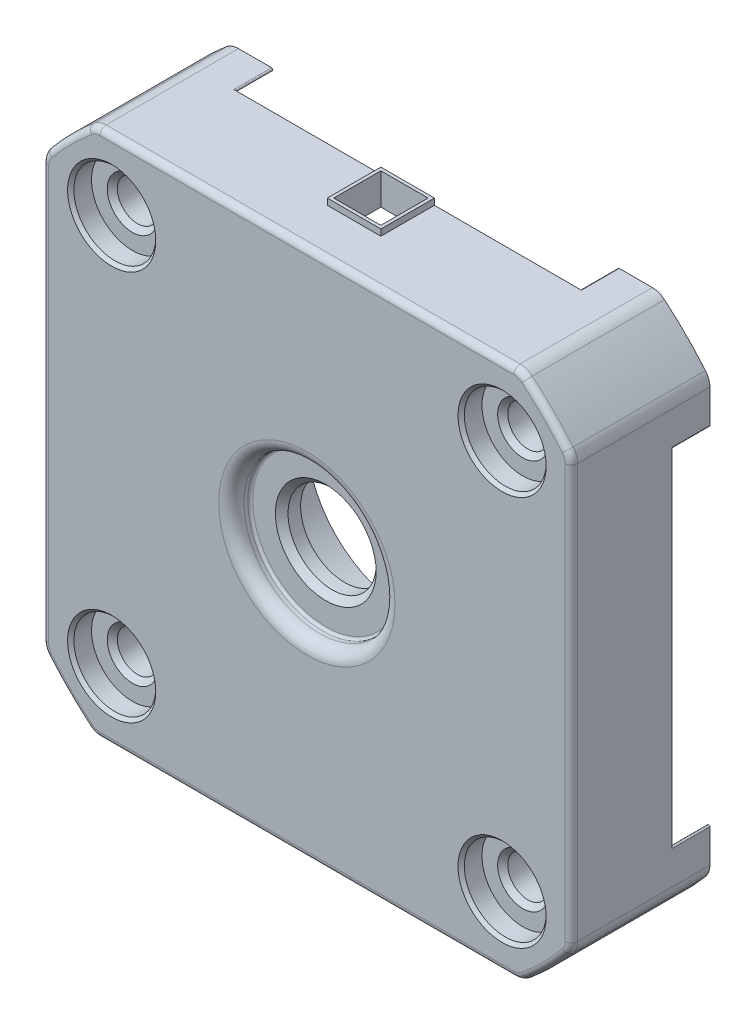
from build123d import *

# Parameters (mm, degrees)
SKETCH1_W                               = 42
SKETCH1_H                               = 42
BOSS_EXTRUDE1_DEPTH                     = 8
BOSS_EXTRUDE2_DEPTH                     = 3
SKETCH3_R                               = 29.69848481
SKETCH3_R_2                             = 27
CUT_EXTRUDE1_DEPTH                      = 11
SKETCH4_R                               = 10
SKETCH4_R_2                             = 8
CUT_EXTRUDE2_DEPTH                      = 5
FILLET3_R                               = 5
FILLET4_R                               = 1.5
FILLET5_START                           = -4
FILLET5_DEPTH                           = 4
FILLET6_R                               = 0.5
FILLET7_R                               = 0.5
CBORE_FOR_M3_PAN_HEAD_SCREW2_AT_2_COUNT = 2
CBORE_FOR_M3_PAN_HEAD_SCREW2_AT_2_PITCH = 43.840620434
CBORE_FOR_M3_PAN_HEAD_SCREW2_AT_3_COUNT = 2
CBORE_FOR_M3_PAN_HEAD_SCREW2_AT_3_PITCH = 31
CBORE_FOR_M3_PAN_HEAD_SCREW2_AT_4_COUNT = 2
CBORE_FOR_M3_PAN_HEAD_SCREW2_AT_4_PITCH = 31
FILLET8_R                               = 1
SKETCH8_W                               = 4.25
SKETCH8_H                               = 4.25
CUT_EXTRUDE3_DEPTH                      = 2
SKETCH9_W                               = 4.25
SKETCH9_H                               = 4.25
SKETCH9_W_2                             = 3.75
SKETCH9_H_2                             = 3.75
BOSS_EXTRUDE3_DEPTH                     = 2.5


with BuildPart() as part:
    # Sketch1 → Boss-Extrude1 (new body)
    with BuildSketch(Plane.XY):
        Rectangle(SKETCH1_W, SKETCH1_H)
    extrude(amount=BOSS_EXTRUDE1_DEPTH)

    # Sketch2 → Boss-Extrude2 (add)
    with BuildSketch(Plane(origin=(0, 0, 0), x_dir=(-1, 0, 0), z_dir=(0, 0, -1))):
        with BuildLine():
            Line((-21, 12.806248475), (-21, 21))
            Line((-21, 21), (-12.806248475, 21))
            ThreePointArc((-12.806248475, 21), (-13.551604467, 20.886303511), (-14.229164972, 20.555555556))
            ThreePointArc((-14.229164972, 20.555555556), (-17.67766953, 17.67766953), (-20.555555556, 14.229164972))
            ThreePointArc((-20.555555556, 14.229164972), (-20.886303511, 13.551604467), (-21, 12.806248475))
        make_face()
        with BuildLine():
            Line((-21, -12.806248475), (-21, -21))
            Line((-21, -21), (-12.806248475, -21))
            ThreePointArc((-12.806248475, -21), (-13.551604467, -20.886303511), (-14.229164972, -20.555555556))
            ThreePointArc((-14.229164972, -20.555555556), (-17.67766953, -17.67766953), (-20.555555556, -14.229164972))
            ThreePointArc((-20.555555556, -14.229164972), (-20.886303511, -13.551604467), (-21, -12.806248475))
        make_face()
        with BuildLine():
            Line((21, 21), (12.806248475, 21))
            ThreePointArc((12.806248475, 21), (13.551604467, 20.886303511), (14.229164972, 20.555555556))
            ThreePointArc((14.229164972, 20.555555556), (17.67766953, 17.67766953), (20.555555556, 14.229164972))
            ThreePointArc((20.555555556, 14.229164972), (20.886303511, 13.551604467), (21, 12.806248475))
            Line((21, 12.806248475), (21, 21))
        make_face()
        with BuildLine():
            Line((21, -12.806248475), (21, -21))
            Line((21, -21), (12.806248475, -21))
            ThreePointArc((12.806248475, -21), (13.551604467, -20.886303511), (14.229164972, -20.555555556))
            ThreePointArc((14.229164972, -20.555555556), (17.67766953, -17.67766953), (20.555555556, -14.229164972))
            ThreePointArc((20.555555556, -14.229164972), (20.886303511, -13.551604467), (21, -12.806248475))
        make_face()
    extrude(amount=BOSS_EXTRUDE2_DEPTH)

    # Sketch3 → Cut-Extrude1 (cut)
    with BuildSketch(Plane(origin=(0, 0, -3), x_dir=(-1, 0, 0), z_dir=(0, 0, -1))):
        Circle(SKETCH3_R)
        Circle(SKETCH3_R_2, mode=Mode.SUBTRACT)
    extrude(amount=-CUT_EXTRUDE1_DEPTH, mode=Mode.SUBTRACT)

    # Sketch4 → Cut-Extrude2 (cut)
    # profile 1 of 2: a face of its own
    with BuildSketch(Plane(origin=(0, 0, 0), x_dir=(-1, 0, 0), z_dir=(0, 0, -1))):
        Polygon((7.870057685, -19), (19, -7.870057685), (19, 7.870057685), (7.870057685, 19), (-7.870057685, 19), (-19, 7.870057685), (-19, -7.870057685), (-7.870057685, -19), align=None)
        Circle(SKETCH4_R, mode=Mode.SUBTRACT)
    # profile 2 of 2: a face of its own
    with BuildSketch(Plane(origin=(0, 0, 0), x_dir=(-1, 0, 0), z_dir=(0, 0, -1))):
        Circle(SKETCH4_R_2)
    extrude(amount=-CUT_EXTRUDE2_DEPTH, mode=Mode.SUBTRACT)

    # Fillet3
    fillet3_edges = [part.edges().sort_by_distance(p)[0] for p in [
        (-19, -7.870057685, 2.5),
        (-7.870057685, -19, 2.5),
        (7.870057685, -19, 2.5),
        (19, -7.870057685, 2.5),
        (19, 7.870057685, 2.5),
        (7.870057685, 19, 2.5),
        (-7.870057685, 19, 2.5),
        (-19, 7.870057685, 2.5),
    ]]
    fillet(fillet3_edges, radius=FILLET3_R)

    # Fillet4
    fillet4_edges = [part.edges().sort_by_distance(p)[0] for p in [
        (21, 16.970562748, 2.5),
        (21, -16.970562748, 2.5),
        (-16.970562748, 21, 2.5),
        (16.970562748, 21, 2.5),
        (-21, -16.970562748, 2.5),
        (-21, 16.970562748, 2.5),
        (16.970562748, -21, 2.5),
        (-16.970562748, -21, 2.5),
    ]]
    fillet(fillet4_edges, radius=FILLET4_R)

    # Fillet5: read off the stored shape, not the designer's step
    # Fillet5 outline → Fillet5 (cut)
    with BuildSketch(Plane.XY.offset(FILLET5_START)):
        with BuildLine():
            ThreePointArc((-13.767786936, 20.807692308), (-13.296538813, 20.95145169), (-12.806248475, 21))
            Line((-12.806248475, 21), (-13.806248475, 21))
            ThreePointArc((-13.806248475, 21), (-13.708190407, 20.919611614), (-13.767786936, 20.807692308))
        make_face()
        with BuildLine():
            ThreePointArc((13.767786936, 20.807692308), (13.708190407, 20.919611614), (13.806248475, 21))
            Line((13.806248475, 21), (12.806248475, 21))
            ThreePointArc((12.806248475, 21), (13.296538813, 20.95145169), (13.767786936, 20.807692308))
        make_face()
        with BuildLine():
            Line((21, -13.806248475), (21, -12.806248475))
            ThreePointArc((21, -12.806248475), (20.95145169, -13.296538813), (20.807692308, -13.767786936))
            ThreePointArc((20.807692308, -13.767786936), (20.919611614, -13.708190407), (21, -13.806248475))
        make_face()
        with BuildLine():
            ThreePointArc((21, 13.806248475), (20.919611614, 13.708190407), (20.807692308, 13.767786936))
            ThreePointArc((20.807692308, 13.767786936), (20.95145169, 13.296538813), (21, 12.806248475))
            Line((21, 12.806248475), (21, 13.806248475))
        make_face()
        with BuildLine():
            Line((-13.806248475, -21), (-12.806248475, -21))
            ThreePointArc((-12.806248475, -21), (-13.296538813, -20.95145169), (-13.767786936, -20.807692308))
            ThreePointArc((-13.767786936, -20.807692308), (-13.708190407, -20.919611614), (-13.806248475, -21))
        make_face()
        with BuildLine():
            ThreePointArc((13.806248475, -21), (13.708190407, -20.919611614), (13.767786936, -20.807692308))
            ThreePointArc((13.767786936, -20.807692308), (13.296538813, -20.95145169), (12.806248475, -21))
            Line((12.806248475, -21), (13.806248475, -21))
        make_face()
        with BuildLine():
            Line((-21, 13.806248475), (-21, 12.806248475))
            ThreePointArc((-21, 12.806248475), (-20.95145169, 13.296538813), (-20.807692308, 13.767786936))
            ThreePointArc((-20.807692308, 13.767786936), (-20.919611614, 13.708190407), (-21, 13.806248475))
        make_face()
        with BuildLine():
            ThreePointArc((-21, -13.806248475), (-20.919611614, -13.708190407), (-20.807692308, -13.767786936))
            ThreePointArc((-20.807692308, -13.767786936), (-20.95145169, -13.296538813), (-21, -12.806248475))
            Line((-21, -12.806248475), (-21, -13.806248475))
        make_face()
    extrude(amount=FILLET5_DEPTH, mode=Mode.SUBTRACT)

    # Fillet6
    fillet6_edges = [part.edges().sort_by_distance(p)[0] for p in [
        (10, 0, 5),
        (-13.435028843, -13.435028843, 5),
        (0, -19, 5),
        (-19, 0, 5),
        (-13.435028843, 13.435028843, 5),
        (0, 19, 5),
        (13.435028843, 13.435028843, 5),
        (19, 0, 5),
        (13.435028843, -13.435028843, 5),
        (7.712407035, 18.619397663, 5),
        (-18.619397663, -7.712407035, 5),
        (-18.619397663, 7.712407035, 5),
        (-7.712407035, 18.619397663, 5),
        (18.619397663, 7.712407035, 5),
        (18.619397663, -7.712407035, 5),
        (7.712407035, -18.619397663, 5),
        (-7.712407035, -18.619397663, 5),
    ]]
    fillet(fillet6_edges, radius=FILLET6_R)

    # Fillet7
    fillet7_edges = [part.edges().sort_by_distance(p)[0] for p in [
        (19.091883092, -19.091883092, 8),
        (21, 0, 8),
        (19.091883092, 19.091883092, 8),
        (0, 21, 8),
        (-19.091883092, 19.091883092, 8),
        (-21, 0, 8),
        (-19.091883092, -19.091883092, 8),
        (0, -21, 8),
        (-16.946172481, -20.909004655, 8),
        (20.909004655, 16.946172481, 8),
        (16.946172481, 20.909004655, 8),
        (-16.946172481, 20.909004655, 8),
        (-20.909004655, 16.946172481, 8),
        (-20.909004655, -16.946172481, 8),
        (16.946172481, -20.909004655, 8),
        (20.909004655, -16.946172481, 8),
    ]]
    fillet(fillet7_edges, radius=FILLET7_R)

    # Sketch6 → CBORE for M3 Pan Head Screw2 (revolve, cut)
    with BuildSketch(Plane(origin=(-15.5, 15.5, 8), x_dir=(0, -1, 0), z_dir=(1, 0, 0))):
        Polygon((0, 0), (0, 11), (1.6, 11), (1.6, 2.05), (2, 1.65), (3.25, 1.65), (3.25, 0.25), (3.5, 0), align=None)
    cbore_for_m3_pan_head_screw2 = revolve(axis=Axis((-15.5, 15.5, 14.35), (0, 0, -1)), mode=Mode.SUBTRACT)

    # CBORE for M3 Pan Head Screw2 at 2: CBORE for M3 Pan Head Screw2 ×2
    with Locations(*[Vector(0.7071067811865476, -0.7071067811865476, 0) * (i * CBORE_FOR_M3_PAN_HEAD_SCREW2_AT_2_PITCH) for i in range(1, CBORE_FOR_M3_PAN_HEAD_SCREW2_AT_2_COUNT)]):
        add(cbore_for_m3_pan_head_screw2, mode=Mode.SUBTRACT)

    # CBORE for M3 Pan Head Screw2 at 3: CBORE for M3 Pan Head Screw2 ×2
    with Locations(*[(0, -i * CBORE_FOR_M3_PAN_HEAD_SCREW2_AT_3_PITCH, 0) for i in range(1, CBORE_FOR_M3_PAN_HEAD_SCREW2_AT_3_COUNT)]):
        add(cbore_for_m3_pan_head_screw2, mode=Mode.SUBTRACT)

    # CBORE for M3 Pan Head Screw2 at 4: CBORE for M3 Pan Head Screw2 ×2
    with Locations(*[(i * CBORE_FOR_M3_PAN_HEAD_SCREW2_AT_4_PITCH, 0, 0) for i in range(1, CBORE_FOR_M3_PAN_HEAD_SCREW2_AT_4_COUNT)]):
        add(cbore_for_m3_pan_head_screw2, mode=Mode.SUBTRACT)

    # Sketch7 → Cut-Revolve1 (revolve, cut)
    with BuildSketch(Plane(origin=(0, 0, 0), x_dir=(0, 0, -1), z_dir=(1, 0, 0)), mode=Mode.PRIVATE) as cut_revolve1_sk:
        with BuildLine():
            Line((-5, 0), (-5, 3.5))
            Line((-5, 3.5), (-6, 3.5))
            Line((-6, 3.5), (-6.5, 4))
            Line((-6.5, 4), (-6.5, 5.8))
            ThreePointArc((-6.5, 5.8), (-6.558578644, 5.941421356), (-6.7, 6))
            Line((-6.7, 6), (-8, 6))
            Line((-8, 6), (-8, 0))
            Line((-8, 0), (-5, 0))
        make_face()
    revolve(cut_revolve1_sk.sketch.rotate(Axis((0, 0, 15.576507328), (0, 0, -1)), 90), axis=Axis((0, 0, 15.576507328), (0, 0, -1)), mode=Mode.SUBTRACT)

    # Fillet8
    fillet8_edges = [part.edges().sort_by_distance(p)[0] for p in [
        (-6, 0, 8),
    ]]
    fillet(fillet8_edges, radius=FILLET8_R)

    # Sketch8 → Cut-Extrude3 (cut)
    with BuildSketch(Plane(origin=(0, 21, 0), x_dir=(1, 0, 0), z_dir=(0, 1, 0))):
        with Locations((0, -2.125)):
            Rectangle(SKETCH8_W, SKETCH8_H)
    extrude(amount=-CUT_EXTRUDE3_DEPTH, mode=Mode.SUBTRACT)


with BuildPart() as body_2:
    # Sketch9 → Boss-Extrude3 (new body)
    with BuildSketch(Plane.XZ.offset(-19)):
        with Locations((0, 2.125)):
            Rectangle(SKETCH9_W, SKETCH9_H)
        with Locations((0, 2.125)):
            Rectangle(SKETCH9_W_2, SKETCH9_H_2, mode=Mode.SUBTRACT)
    extrude(amount=-BOSS_EXTRUDE3_DEPTH)


solid = Compound([part.part, body_2.part])
